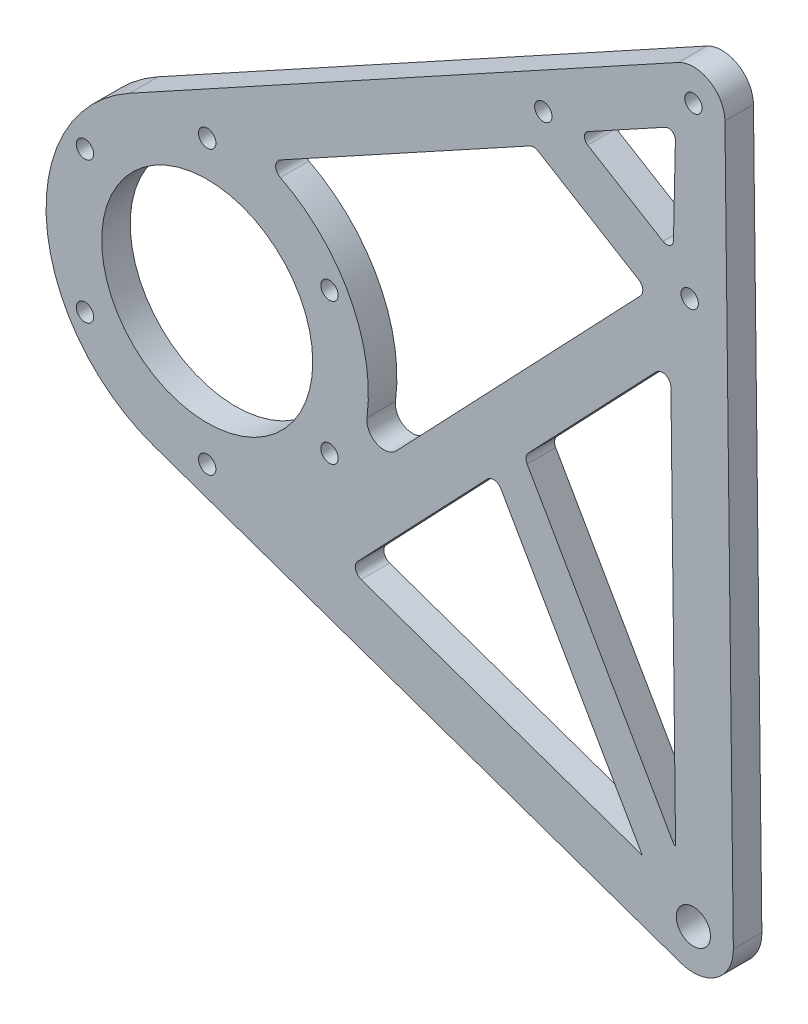
from build123d import *

# Parameters (mm, degrees)
SKETCH_1_R               = 18.5
SKETCH_1_R_2             = 1.525
SKETCH_1_R_3             = 3
EXTRUDE_1_DEPTH          = 2.5
SKETCH_4_R               = 1.525
CUT_EXTRUDE_3_DEPTH      = 10
PATTERN_CIRCULAR_2_COUNT = 6
SKETCH_5_R               = 1.525
CUT_EXTRUDE_4_DEPTH      = 31.54
CUT_EXTRUDE_5_DEPTH      = 31.54
EXTRUDE_2_DEPTH          = 5
EXTRUDE_3_DEPTH          = 5
FILLET_START             = -2.5
FILLET_2_DEPTH           = 5
CUT_EXTRUDE_7_DEPTH      = 5
FILLET_4_R               = 1.2


with BuildPart() as part:
    # 草图1 → 凸台-拉伸1 (new, symmetric)
    with BuildSketch(Plane.XY):
        with BuildLine():
            Line((-94.548784095, -99.337249729), (-2.310865067, -131.595640783))
            ThreePointArc((-2.310865067, -131.595640783), (4.084783214, -130.672665207), (6.99951255, -124.905468856))
            Line((6.99951255, -124.905468856), (5.524615263, 0.065201219))
            ThreePointArc((5.524615263, 0.065201219), (2.786503665, 4.770851321), (-2.657304464, 4.84400227))
            Line((-2.657304464, 4.84400227), (-98.809915302, -47.903033704))
            ThreePointArc((-98.809915302, -47.903033704), (-113.376342219, -75.003424702), (-94.548784095, -99.337249729))
        make_face()
        with Locations((-85.222792931, -72.671009109)):
            Circle(SKETCH_1_R, mode=Mode.SUBTRACT)
        Circle(SKETCH_1_R_2, mode=Mode.SUBTRACT)
        with Locations((0, -124.988076735)):
            Circle(SKETCH_1_R_3, mode=Mode.SUBTRACT)
    extrude(amount=EXTRUDE_1_DEPTH, both=True)

    # 草图4 → 切除-拉伸3 (cut)
    with BuildSketch(Plane.XY.offset(2.5)):
        with Locations((-85.222792931, -47.921009109)):
            Circle(SKETCH_4_R)
    cut_extrude_3 = extrude(amount=-CUT_EXTRUDE_3_DEPTH, mode=Mode.SUBTRACT)

    # 阵列(圆周)2: 切除-拉伸3 ×6 about axis
    pattern_circular_2_axis = Axis((-85.222792931, -72.671009109, 0), (0, 0, 1))
    for i in range(1, PATTERN_CIRCULAR_2_COUNT):
        add(cut_extrude_3.rotate(pattern_circular_2_axis, i * 360 / PATTERN_CIRCULAR_2_COUNT), mode=Mode.SUBTRACT)

    # 草图5 → 切除-拉伸4 (cut)
    with BuildSketch(Plane.XY.offset(2.5)):
        with Locations((-0.655427857, -29.992839384)):
            Circle(SKETCH_5_R)
        with Locations((-26.302274767, -14.428802517)):
            Circle(SKETCH_5_R)
    extrude(amount=-CUT_EXTRUDE_4_DEPTH, mode=Mode.SUBTRACT)

    # 草图6 → 切除-拉伸5 (cut)
    with BuildSketch(Plane.XY.offset(2.5)):
        with BuildLine():
            Line((-75.094363285, -46.299103359), (-27.959039434, -20.441785485))
            Line((-27.959039434, -20.441785485), (-4.062911687, -34.943381511))
            Line((-4.062911687, -34.943381511), (-3.124682468, -114.441211823))
            ThreePointArc((-3.124682468, -114.441211823), (-6.418945051, -116.055151994), (-8.999327109, -118.662563983))
            Line((-8.999327109, -118.662563983), (-70.892608691, -97.016610758))
            ThreePointArc((-70.892608691, -97.016610758), (-57.069243644, -70.338593517), (-75.094363285, -46.299103359))
        make_face()
    extrude(amount=-CUT_EXTRUDE_5_DEPTH, mode=Mode.SUBTRACT)

    # 草图7 → 凸台-拉伸2 (add)
    with BuildSketch(Plane.XY.offset(2.5)):
        with BuildLine():
            Line((-65.109328248, -99.039198909), (-60.447667843, -100.669522597))
            Line((-60.447667843, -100.669522597), (-3.986848357, -41.388362786))
            Line((-3.986848357, -41.388362786), (-4.062911687, -34.943381511))
            Line((-4.062911687, -34.943381511), (-8.001104314, -32.553451262))
            Line((-8.001104314, -32.553451262), (-64.766339632, -92.154233135))
            ThreePointArc((-64.766339632, -92.154233135), (-67.660383733, -94.798464524), (-70.892608691, -97.016610758))
            Line((-70.892608691, -97.016610758), (-65.109328248, -99.039198909))
        make_face()
    extrude(amount=-EXTRUDE_2_DEPTH)

    # 草图8 → 凸台-拉伸3 (add)
    with BuildSketch(Plane(origin=(0, 0, -2.5), x_dir=(-1, 0, 0), z_dir=(0, 0, -1))):
        Polygon((8.398824834, -119.639882413), (35.254100893, -72.768938625), (29.6986281, -68.384501663), (2.325139246, -116.159890547), align=None)
    extrude(amount=-EXTRUDE_3_DEPTH)

    # 圆角2: read off the stored shape, not the designer's step
    # 圆角2 outline → 圆角2 (add)
    with BuildSketch(Plane.XY.offset(FILLET_START)):
        with BuildLine():
            ThreePointArc((-52.068137932, -78.821728734), (-55.534618391, -79.459237326), (-57.214804329, -76.360870144))
            ThreePointArc((-57.214804329, -76.360870144), (-59.736362996, -84.857246804), (-64.766339632, -92.154233135))
            Line((-64.766339632, -92.154233135), (-52.068137932, -78.821728734))
        make_face()
        with BuildLine():
            ThreePointArc((-75.094363285, -46.299103359), (-73.733280759, -46.862994656), (-72.403446669, -47.497076929))
            ThreePointArc((-72.403446669, -47.497076929), (-73.222596192, -46.183465315), (-72.444213542, -44.845294226))
            Line((-72.444213542, -44.845294226), (-75.094363285, -46.299103359))
        make_face()
        with BuildLine():
            ThreePointArc((-9.594656237, -31.586388879), (-8.885938003, -32.671073224), (-9.286674719, -33.903238695))
            Line((-9.286674719, -33.903238695), (-8.001104314, -32.553451262))
            Line((-8.001104314, -32.553451262), (-9.594656237, -31.586388879))
        make_face()
        with BuildLine():
            Line((-27.959039434, -20.441785485), (-28.718320704, -20.858309136))
            ThreePointArc((-28.718320704, -20.858309136), (-27.964109185, -20.673780905), (-27.218678735, -20.891080529))
            Line((-27.218678735, -20.891080529), (-27.959039434, -20.441785485))
        make_face()
        with BuildLine():
            ThreePointArc((-6.52942074, -44.057942172), (-4.894363129, -43.696477917), (-3.943341833, -45.074747954))
            Line((-3.943341833, -45.074747954), (-3.986848357, -41.388362786))
            Line((-3.986848357, -41.388362786), (-6.52942074, -44.057942172))
        make_face()
        with BuildLine():
            ThreePointArc((-3.282371439, -114.489217858), (-3.203616876, -114.464919466), (-3.124682468, -114.441211823))
            ThreePointArc((-3.124682468, -114.441211823), (-3.391983975, -114.215991533), (-3.599904234, -113.93502278))
            Line((-3.599904234, -113.93502278), (-3.282371439, -114.489217858))
        make_face()
        with BuildLine():
            ThreePointArc((-29.142637234, -69.354881433), (-29.330280124, -68.429053989), (-28.927316541, -67.57466142))
            Line((-28.927316541, -67.57466142), (-29.6986281, -68.384501663))
            Line((-29.6986281, -68.384501663), (-29.142637234, -69.354881433))
        make_face()
        with BuildLine():
            ThreePointArc((-36.123402256, -75.130207215), (-34.857103993, -74.675567741), (-33.73571484, -75.419002143))
            Line((-33.73571484, -75.419002143), (-34.7358881, -73.67338372))
            Line((-34.7358881, -73.67338372), (-36.123402256, -75.130207215))
        make_face()
        with BuildLine():
            Line((-8.976957664, -118.630857917), (-9.129347243, -118.364889943))
            ThreePointArc((-9.129347243, -118.364889943), (-9.05625561, -118.510197041), (-8.999327109, -118.662563983))
            ThreePointArc((-8.999327109, -118.662563983), (-8.988156367, -118.646701086), (-8.976957664, -118.630857917))
        make_face()
        with BuildLine():
            ThreePointArc((-58.2536461, -101.436838383), (-59.216649338, -100.372621972), (-58.844644089, -98.986424331))
            Line((-58.844644089, -98.986424331), (-60.447667843, -100.669522597))
            Line((-60.447667843, -100.669522597), (-58.2536461, -101.436838383))
        make_face()
    extrude(amount=FILLET_2_DEPTH)

    # 草图12 → 切除-拉伸7 (cut)
    with BuildSketch(Plane.XY.offset(2.5)):
        Polygon((-3.112807373, -5.129369382), (-20.30370689, -14.559888089), (-3.541188361, -24.732384431), align=None)
    extrude(amount=-CUT_EXTRUDE_7_DEPTH, mode=Mode.SUBTRACT)

    # 圆角4
    fillet_4_edges = [part.edges().sort_by_distance(p)[0] for p in [
        (-3.112807373, -5.129369382, 0),
        (-3.541188361, -24.732384431, 0),
        (-20.30370689, -14.559888089, 0),
    ]]
    fillet(fillet_4_edges, radius=FILLET_4_R)


solid = part.part
